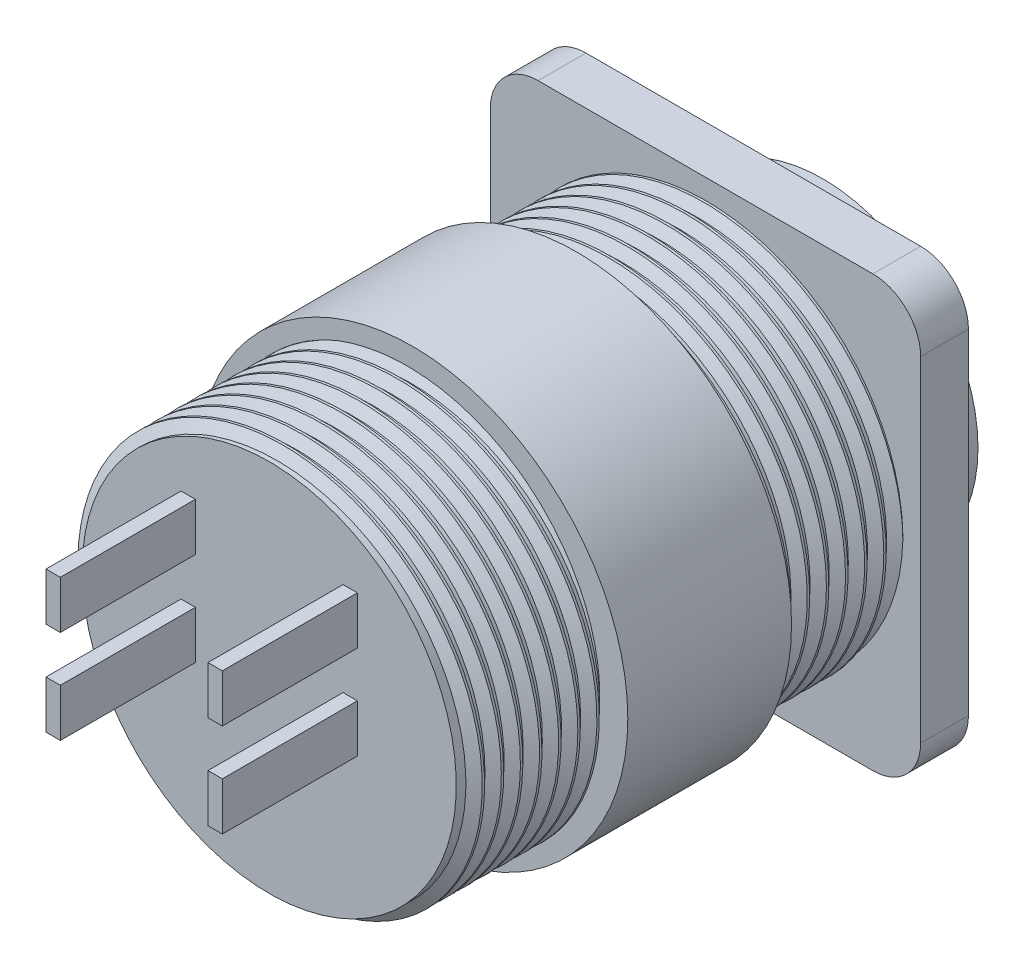
from build123d import *

# Parameters (mm, degrees)
SKETCH1_R           = 7.825
SKETCH1_R_2         = 6.5
BOSS_EXTRUDE1_DEPTH = 18.25
SKETCH1_3_R         = 6.5
BOSS_EXTRUDE2_DEPTH = 4.9
SKETCH2_W           = 18
SKETCH2_H           = 18
BOSS_EXTRUDE3_DEPTH = 2
THREAD2_PITCH       = 0.8
BOSS_EXTRUDE4_START = -12.85
SKETCH12_R          = 9
SKETCH12_R_2        = 7.825
BOSS_EXTRUDE4_DEPTH = 6.85
FILLET1_R           = 2
SKETCH13_W          = 0.6
SKETCH13_H          = 1
SKETCH13_H_2        = 2
BOSS_EXTRUDE5_DEPTH = 5.65


with BuildPart() as part:
    # Sketch1 → Boss-Extrude1 (new body)
    # profile 1 of 2: a face of its own
    with BuildSketch(Plane.XY):
        Circle(SKETCH1_R)
        Circle(SKETCH1_R_2, mode=Mode.SUBTRACT)
    # profile 2 of 2: a face of its own
    with BuildSketch(Plane.XY):
        Circle(SKETCH1_R_2)
    extrude(amount=BOSS_EXTRUDE1_DEPTH)

    # Sketch1<3> → Boss-Extrude2 (add)
    with BuildSketch(Plane.XY):
        Circle(SKETCH1_3_R)
    extrude(amount=-BOSS_EXTRUDE2_DEPTH)

    # Sketch2 → Boss-Extrude3 (add)
    with BuildSketch(Plane.XY):
        Rectangle(SKETCH2_W, SKETCH2_H)
    extrude(amount=-BOSS_EXTRUDE3_DEPTH)

    # Thread2: the profile of Thread Profile2 profile screwed along a right-hand helix of 22.8125 turns, 8 arcs to a turn; built about Z, then put on its axis
    thread2_z = Axis((0, 0, 0), (0, 0, 1))
    thread2_corners = [(7.8247, 0, -0.000173205), (8.2580127, 0, 0.249999999), (8.2580127, 0, 0.349999999), (7.8247, 0, 0.600173203)]
    with BuildLine(mode=Mode.PRIVATE) as thread2_profile:
        Line(thread2_corners[0], thread2_corners[1])
        Line(thread2_corners[1], thread2_corners[2])
        Line(thread2_corners[2], thread2_corners[3])
        Line(thread2_corners[3], thread2_corners[0])
    thread2_cap = Face(thread2_profile.wire())
    thread2_turn_angles = [0, 22.5, 45, 67.5, 90, 112.5, 135, 157.5, 180, 202.5, 225, 247.5, 270, 292.5, 315, 337.5, 360]
    thread2_turn_weights = [1, 0.9238795325112867, 1, 0.9238795325112867, 1, 0.9238795325112867, 1, 0.9238795325112867, 1, 0.9238795325112867, 1, 0.9238795325112867, 1, 0.9238795325112867, 1, 0.9238795325112867, 1]
    thread2_turn_rails = [Edge.make_bspline([Vector(p[0], p[1], 0).rotate(thread2_z, thread2_turn_angles[k]) / thread2_turn_weights[k] + Vector(0, 0, p[2] + THREAD2_PITCH * thread2_turn_angles[k] / 360) for k in range(17)], [0, 0, 0, 1, 1, 2, 2, 3, 3, 4, 4, 5, 5, 6, 6, 7, 7, 8, 8, 8], 2, thread2_turn_weights) for p in thread2_corners]
    thread2_turn_sides = [Face.make_surface_from_curves(thread2_turn_rails[p[0]], thread2_turn_rails[p[1]]) for p in [(0, 1), (1, 2), (2, 3), (3, 0)]]
    thread2_last_angles = [7920, 7942.5, 7965, 7987.5, 8010, 8032.5, 8055, 8077.5, 8100, 8122.5, 8145, 8167.5, 8190, 8201.25, 8212.5]
    thread2_last_weights = [1, 0.9238795325112867, 1, 0.9238795325112867, 1, 0.9238795325112867, 1, 0.9238795325112867, 1, 0.9238795325112867, 1, 0.9238795325112867, 1, 0.9807852804032304, 1]
    thread2_last_rails = [Edge.make_bspline([Vector(p[0], p[1], 0).rotate(thread2_z, thread2_last_angles[k]) / thread2_last_weights[k] + Vector(0, 0, p[2] + THREAD2_PITCH * thread2_last_angles[k] / 360) for k in range(15)], [0, 0, 0, 1, 1, 2, 2, 3, 3, 4, 4, 5, 5, 6, 6, 7, 7, 7], 2, thread2_last_weights) for p in thread2_corners]
    thread2_last_sides = [Face.make_surface_from_curves(thread2_last_rails[p[0]], thread2_last_rails[p[1]]) for p in [(0, 1), (1, 2), (2, 3), (3, 0)]]
    thread2 = Plane(origin=(0, 0, 18.25), x_dir=(-1, 0, 0), z_dir=(0, 0, -1)) * Solid(Shell([*[p.moved(Location((0, 0, THREAD2_PITCH * i))) for i in range(22) for p in thread2_turn_sides], *thread2_last_sides, thread2_cap, thread2_cap.rotate(thread2_z, 8212.5).moved(Location((0, 0, THREAD2_PITCH * 8212.5 / 360)))]))
    add(thread2)

    # Sketch12 → Boss-Extrude4 (add)
    with BuildSketch(Plane.XY.offset(18.25).offset(BOSS_EXTRUDE4_START)):
        Circle(SKETCH12_R)
        Circle(SKETCH12_R_2, mode=Mode.SUBTRACT)
    extrude(amount=BOSS_EXTRUDE4_DEPTH)

    # Fillet1
    fillet1_edges = [part.edges().sort_by_distance(p)[0] for p in [
        (-9, -9, -1),
        (-9, 9, -1),
        (9, 9, -1),
        (9, -9, -1),
    ]]
    fillet(fillet1_edges, radius=FILLET1_R)

    # Sketch13 → Boss-Extrude5 (add)
    with BuildSketch(Plane.XY.offset(18.25)):
        with Locations((3.388324392, -0.5)):
            Rectangle(SKETCH13_W, SKETCH13_H)
        with Locations((3.388324392, 0.5)):
            Rectangle(SKETCH13_W, SKETCH13_H)
        with Locations((3.388324392, 3.9125)):
            Rectangle(SKETCH13_W, SKETCH13_H_2)
        with Locations((-3.388324392, 3.9125)):
            Rectangle(SKETCH13_W, SKETCH13_H_2)
        with Locations((-3.388324392, 0.5)):
            Rectangle(SKETCH13_W, SKETCH13_H)
        with Locations((-3.388324392, -0.5)):
            Rectangle(SKETCH13_W, SKETCH13_H)
    extrude(amount=BOSS_EXTRUDE5_DEPTH)


solid = part.part
